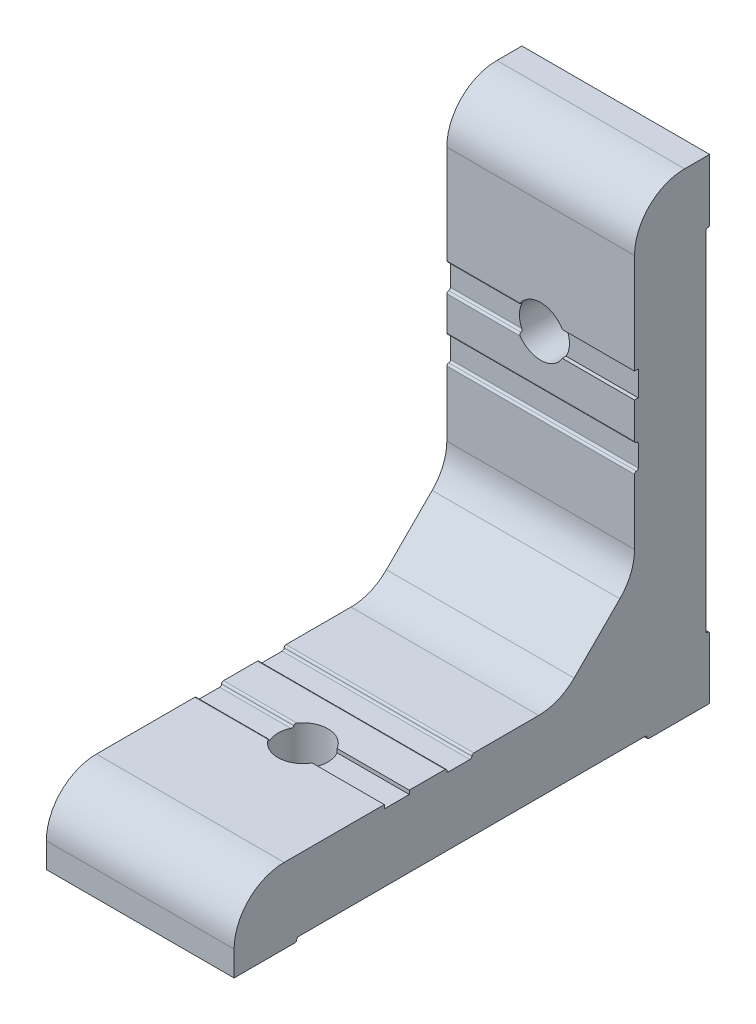
from build123d import *

# Parameters (mm, degrees)
ESBO_O1_W                  = 38
ESBO_O1_H                  = 38
RESSALTO_EXTRUS_O1_DEPTH   = 15
CORTE_EXTRUS_O1_DEPTH      = 52.28352562
ESBO_O7_W                  = 0.3
ESBO_O7_H                  = 28
ESBO_O7_W_2                = 28
ESBO_O7_H_2                = 0.3
ESBO_O7_W_3                = 2
ESBO_O7_H_3                = 2
CORTE_EXTRUS_O2_DEPTH      = 52.28352562
FURO_DE_DI_METRO_7_0_7_3_D = 4
FURO_DE_DI_METRO_7_0_7_2_D = 4
FILETE1_R                  = 4
FILETE2_R                  = 0.15


with BuildPart() as part:
    # Esboço1 → Ressalto-extrusão1 (new body)
    with BuildSketch(Plane(origin=(10, 0, 0), x_dir=(0, 0, -1), z_dir=(1, 0, 0))):
        with Locations((-12, 19)):
            Rectangle(ESBO_O1_W, ESBO_O1_H)
    extrude(amount=-RESSALTO_EXTRUS_O1_DEPTH)

    # Esboço2 → Corte-extrusão1 (cut, through all)
    with BuildSketch(Plane.ZY.offset(5)):
        Polygon((31, 38), (-1, 38), (-1, 12), (5, 6), (31, 6), align=None)
    extrude(amount=-CORTE_EXTRUS_O1_DEPTH, mode=Mode.SUBTRACT)

    # Esboço7 → Corte-extrusão2 (cut, through all)
    with BuildSketch(Plane(origin=(10, 0, 0), x_dir=(0, 0, -1), z_dir=(1, 0, 0))):
        with Locations((6.85, 19)):
            Rectangle(ESBO_O7_W, ESBO_O7_H)
        with Locations((-12, 0.15)):
            Rectangle(ESBO_O7_W_2, ESBO_O7_H_2)
        with Locations((-13, 5.85)):
            Rectangle(ESBO_O7_W_3, ESBO_O7_H_2)
        with Locations((1.15, 20)):
            Rectangle(ESBO_O7_W, ESBO_O7_H_3)
        with Locations((-18, 5.85)):
            Rectangle(ESBO_O7_W_3, ESBO_O7_H_2)
        with Locations((1.15, 25)):
            Rectangle(ESBO_O7_W, ESBO_O7_H_3)
    extrude(amount=-CORTE_EXTRUS_O2_DEPTH, mode=Mode.SUBTRACT)

    # Furo de diâmetro Ø7.0 (7)3 (through all)
    with Locations(Plane(origin=(0, 6, 0), x_dir=(1, 0, 0), z_dir=(0, 1, 0))):
        with Locations((2.5, -18)):
            Hole(FURO_DE_DI_METRO_7_0_7_3_D / 2)

    # Furo de diâmetro Ø7.0 (7)2 (through all)
    with Locations(Plane(origin=(0, 0, -7), x_dir=(-1, 0, 0), z_dir=(0, 0, -1))):
        with Locations((-2.5, 25)):
            Hole(FURO_DE_DI_METRO_7_0_7_2_D / 2)

    # Filete1
    filete1_edges = [part.edges().sort_by_distance(p)[0] for p in [
        (2.5, 6, 31),
        (2.5, 6, 5),
        (2.5, 12, -1),
        (2.5, 38, -1),
    ]]
    fillet(filete1_edges, radius=FILETE1_R)

    # Filete2
    filete2_edges = [part.edges().sort_by_distance(p)[0] for p in [
        (2.5, 5, -7),
        (2.5, 5, -6.7),
        (2.5, 33, -7),
        (2.5, 33, -6.7),
        (2.5, 0, 26),
        (2.5, 0.3, 26),
        (2.5, 0.3, -2),
        (2.5, 0, -2),
        (2.5, 19, -1.3),
        (2.5, 19, -1),
        (2.5, 21, -1.3),
        (2.5, 21, -1),
        (2.5, 5.7, 14),
        (2.5, 6, 14),
        (2.5, 5.7, 12),
        (2.5, 6, 12),
        (-2.116025404, 26, -1.3),
        (-2.116025404, 24, -1.3),
        (-2.116025404, 24, -1),
        (-2.116025404, 26, -1),
        (-2.116025404, 5.7, 19),
        (-2.116025404, 5.7, 17),
        (-2.116025404, 6, 17),
        (-2.116025404, 6, 19),
    ]]
    fillet(filete2_edges, radius=FILETE2_R - 0.0001)  # a hair under: the kernel refuses the full size


solid = part.part
